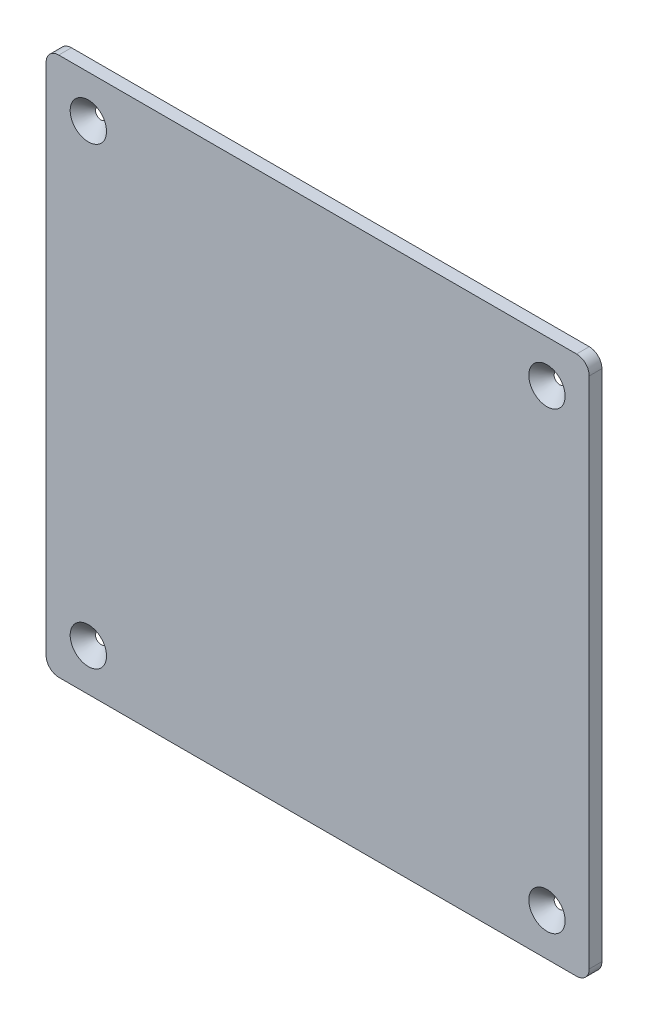
from build123d import *

# Parameters (mm, degrees)
EXTRUDE_1_DEPTH     = 3
EXTRUDE_1_2_DEPTH   = 2
SKETCH_3_R          = 1.3
CUT_EXTRUDE_1_DEPTH = 5
CHAMFER_1_SIZE      = 3


with BuildPart() as part:
    # Эскиз1 → Extrude 1 (new body)
    with BuildSketch(Plane.XY):
        with BuildLine():
            Line((-64.25, 60.75), (-64.25, -60.75))
            ThreePointArc((-64.25, -60.75), (-63.371320344, -62.871320344), (-61.25, -63.75))
            Line((-61.25, -63.75), (61.25, -63.75))
            ThreePointArc((61.25, -63.75), (63.371320344, -62.871320344), (64.25, -60.75))
            Line((64.25, -60.75), (64.25, 60.75))
            ThreePointArc((64.25, 60.75), (63.371320344, 62.871320344), (61.25, 63.75))
            Line((61.25, 63.75), (-61.25, 63.75))
            ThreePointArc((-61.25, 63.75), (-63.371320344, 62.871320344), (-64.25, 60.75))
        make_face()
    extrude(amount=EXTRUDE_1_DEPTH)

    # Эскиз2 → Extrude 1 2 (add)
    with BuildSketch(Plane(origin=(0, 0, 0), x_dir=(-1, 0, 0), z_dir=(0, 0, -1))):
        with BuildLine():
            Line((-44.25, -57.75), (44.25, -57.75))
            ThreePointArc((44.25, -57.75), (47.078427125, -56.578427125), (48.25, -53.75))
            ThreePointArc((48.25, -53.75), (50.007359313, -49.507359313), (54.25, -47.75))
            ThreePointArc((54.25, -47.75), (57.078427125, -46.578427125), (58.25, -43.75))
            Line((58.25, -43.75), (58.25, 43.75))
            ThreePointArc((58.25, 43.75), (57.078427125, 46.578427125), (54.25, 47.75))
            ThreePointArc((54.25, 47.75), (50.007359313, 49.507359313), (48.25, 53.75))
            ThreePointArc((48.25, 53.75), (47.078427125, 56.578427125), (44.25, 57.75))
            Line((44.25, 57.75), (-44.25, 57.75))
            ThreePointArc((-44.25, 57.75), (-47.078427125, 56.578427125), (-48.25, 53.75))
            ThreePointArc((-48.25, 53.75), (-50.007359313, 49.507359313), (-54.25, 47.75))
            ThreePointArc((-54.25, 47.75), (-57.078427125, 46.578427125), (-58.25, 43.75))
            Line((-58.25, 43.75), (-58.25, -43.75))
            ThreePointArc((-58.25, -43.75), (-57.078427125, -46.578427125), (-54.25, -47.75))
            ThreePointArc((-54.25, -47.75), (-50.007359313, -49.507359313), (-48.25, -53.75))
            ThreePointArc((-48.25, -53.75), (-47.078427125, -56.578427125), (-44.25, -57.75))
        make_face()
        with BuildLine():
            Line((-44.25, -54.75), (44.25, -54.75))
            ThreePointArc((44.25, -54.75), (44.957106781, -54.457106781), (45.25, -53.75))
            ThreePointArc((45.25, -53.75), (47.886038969, -47.386038969), (54.25, -44.75))
            ThreePointArc((54.25, -44.75), (54.957106781, -44.457106781), (55.25, -43.75))
            Line((55.25, -43.75), (55.25, 43.75))
            ThreePointArc((55.25, 43.75), (54.957106781, 44.457106781), (54.25, 44.75))
            ThreePointArc((54.25, 44.75), (47.886038969, 47.386038969), (45.25, 53.75))
            ThreePointArc((45.25, 53.75), (44.957106781, 54.457106781), (44.25, 54.75))
            Line((44.25, 54.75), (-44.25, 54.75))
            ThreePointArc((-44.25, 54.75), (-44.957106781, 54.457106781), (-45.25, 53.75))
            ThreePointArc((-45.25, 53.75), (-47.886038969, 47.386038969), (-54.25, 44.75))
            ThreePointArc((-54.25, 44.75), (-54.957106781, 44.457106781), (-55.25, 43.75))
            Line((-55.25, 43.75), (-55.25, -43.75))
            ThreePointArc((-55.25, -43.75), (-54.957106781, -44.457106781), (-54.25, -44.75))
            ThreePointArc((-54.25, -44.75), (-47.886038969, -47.386038969), (-45.25, -53.75))
            ThreePointArc((-45.25, -53.75), (-44.957106781, -54.457106781), (-44.25, -54.75))
        make_face(mode=Mode.SUBTRACT)
    extrude(amount=EXTRUDE_1_2_DEPTH)

    # Эскиз3 → Вырез-Вытянуть1 (cut)
    with BuildSketch(Plane.XY.offset(3)):
        with Locations((54.25, -53.75)):
            Circle(SKETCH_3_R)
        with Locations((54.25, 53.75)):
            Circle(SKETCH_3_R)
        with Locations((-54.25, 53.75)):
            Circle(SKETCH_3_R)
        with Locations((-54.25, -53.75)):
            Circle(SKETCH_3_R)
    extrude(amount=-CUT_EXTRUDE_1_DEPTH, mode=Mode.SUBTRACT)

    # Фаска1
    chamfer_1_edges = [part.edges().sort_by_distance(p)[0] for p in [
        (-55.55, -53.75, 3),
        (-55.55, 53.75, 3),
        (52.95, 53.75, 3),
        (52.95, -53.75, 3),
    ]]
    chamfer(chamfer_1_edges, length=CHAMFER_1_SIZE - 0.0001)  # a hair under: the kernel refuses the full size


solid = part.part
